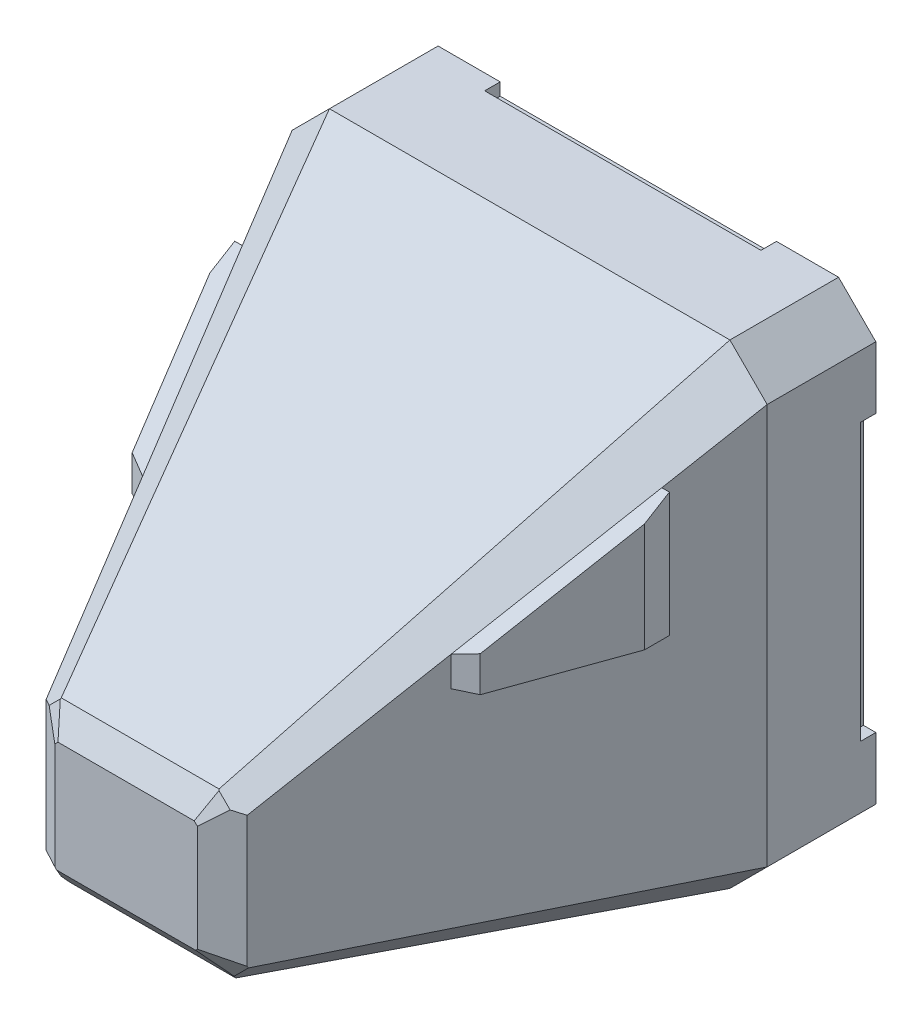
from build123d import *
from OCP.BRepFilletAPI import BRepFilletAPI_MakeChamfer

# Parameters (mm, degrees)
BOSS_EXTRUDE1_DEPTH            = 55
SKETCH2_W                      = 67.5
SKETCH2_H                      = 67.5
BOSS_EXTRUDE2_DEPTH            = 2.5
CUT_EXTRUDE1_REACH             = 75.378
SKETCH3_W                      = 16.5
SKETCH3_H                      = 7
SKETCH3_W_2                    = 8
SKETCH3_H_2                    = 16
FILLET1_R                      = 1
CUT_EXTRUDE2_REACH             = 77.187
SKETCH4_R                      = 1.5
MIRROR2_COPY_1_REACH           = 77.187
MIRROR2_COPY_1_SKETCH_R        = 1.5
BOSS_EXTRUDE3_DEPTH            = 16.09
BOSS_EXTRUDE3_DEPTH_BACK       = 23.81
BOSS_EXTRUDE4_DEPTH            = 47
SKETCH7_W                      = 39.9
SKETCH7_H                      = 19.5
CUT_EXTRUDE3_DEPTH             = 9.4
BOSS_EXTRUDE7_DEPTH            = 2
CUT_EXTRUDE6_REACH             = 85.213
CUT_EXTRUDE6_DIRECTION_2_DEPTH = 84.213490493
CUT_EXTRUDE7_REACH             = 74.438
SKETCH14_W                     = 14.7
SKETCH14_H                     = 2
CUT_EXTRUDE8_DEPTH             = 104.526192338
CUT_EXTRUDE8_DEPTH_BACK        = 2.5
SKETCH15_R                     = 1.6
SKETCH16_W                     = 7.5
SKETCH16_H                     = 2.5
BOSS_EXTRUDE8_DEPTH            = 7
CUT_EXTRUDE5_DEPTH             = 2
CUT_EXTRUDE9_REACH             = 74.438
SKETCH17_R                     = 1
SKETCH19_R                     = 3
CUT_EXTRUDE10_DEPTH            = 2.5
BOSS_EXTRUDE9_DEPTH            = 2
CIRPATTERN1_COUNT              = 4
CIRPATTERN2_COUNT              = 4
CUT_EXTRUDE11_DEPTH            = 2.5
BOSS_EXTRUDE12_DEPTH           = 55
CUT_EXTRUDE12_DEPTH            = 85.104012984
CUT_EXTRUDE12_DEPTH_BACK       = 85.104012984
SKETCH23_W                     = 53.743256412
SKETCH23_H                     = 84.17088144
BOSS_EXTRUDE13_DEPTH           = 15
BOSS_EXTRUDE14_DEPTH           = 35
BOSS_EXTRUDE14_DEPTH_BACK      = 35
CUT_EXTRUDE13_REACH            = 94.676
CHAMFER2_SIZE                  = 1.6
CHAMFER2_SIZE2                 = 2.645578105


with BuildPart() as part:
    # Sketch1 → Boss-Extrude1 (new body)
    with BuildSketch(Plane.XY):
        with BuildLine():
            Line((-36.25, 32.25), (-36.25, -32.25))
            ThreePointArc((-36.25, -32.25), (-35.078427125, -35.078427125), (-32.25, -36.25))
            Line((-32.25, -36.25), (32.25, -36.25))
            ThreePointArc((32.25, -36.25), (35.078427125, -35.078427125), (36.25, -32.25))
            Line((36.25, -32.25), (36.25, 32.25))
            ThreePointArc((36.25, 32.25), (35.078427125, 35.078427125), (32.25, 36.25))
            Line((32.25, 36.25), (-32.25, 36.25))
            ThreePointArc((-32.25, 36.25), (-35.078427125, 35.078427125), (-36.25, 32.25))
        make_face()
        with BuildLine():
            Line((-31.75, 33.75), (31.75, 33.75))
            ThreePointArc((31.75, 33.75), (33.164213562, 33.164213562), (33.75, 31.75))
            Line((33.75, 31.75), (33.75, -31.75))
            ThreePointArc((33.75, -31.75), (33.164213562, -33.164213562), (31.75, -33.75))
            Line((31.75, -33.75), (-31.75, -33.75))
            ThreePointArc((-31.75, -33.75), (-33.164213562, -33.164213562), (-33.75, -31.75))
            Line((-33.75, -31.75), (-33.75, 31.75))
            ThreePointArc((-33.75, 31.75), (-33.164213562, 33.164213562), (-31.75, 33.75))
        make_face(mode=Mode.SUBTRACT)
    extrude(amount=BOSS_EXTRUDE1_DEPTH)

    # Sketch2 → Boss-Extrude2 (add)
    with BuildSketch(Plane.XY):
        Rectangle(SKETCH2_W, SKETCH2_H)
    extrude(amount=BOSS_EXTRUDE2_DEPTH)

    # Sketch3 → Cut-Extrude1 (cut, up to next)
    with BuildSketch(Plane.XY.offset(2.5), mode=Mode.PRIVATE) as cut_extrude1_sk1:
        with Locations((-11.63, 14.79)):
            Rectangle(SKETCH3_W, SKETCH3_H)
    cut_extrude1_tool1 = extrude(cut_extrude1_sk1.sketch, amount=-CUT_EXTRUDE1_REACH, mode=Mode.PRIVATE) & part.part
    # Sketch3 → Cut-Extrude1 (cut, up to next)
    with BuildSketch(Plane.XY.offset(2.5), mode=Mode.PRIVATE) as cut_extrude1_sk2:
        Rectangle(SKETCH3_W_2, SKETCH3_H_2)
    cut_extrude1_tool2 = extrude(cut_extrude1_sk2.sketch, amount=-CUT_EXTRUDE1_REACH, mode=Mode.PRIVATE) & part.part
    add(cut_extrude1_tool1.solids().sort_by_distance((-11.63, 14.79, 2.5))[0], mode=Mode.SUBTRACT)
    add(cut_extrude1_tool2.solids().sort_by_distance((0, 0, 2.5))[0], mode=Mode.SUBTRACT)

    # Fillet1
    fillet1_edges = [part.edges().sort_by_distance(p)[0] for p in [
        (-19.88, 11.29, 1.25),
        (-19.88, 18.29, 1.25),
        (-3.38, 18.29, 1.25),
        (-3.38, 11.29, 1.25),
        (4, -8, 1.25),
        (-4, -8, 1.25),
        (-4, 8, 1.25),
        (4, 8, 1.25),
    ]]
    fillet(fillet1_edges, radius=FILLET1_R)

    # Sketch4 → Cut-Extrude2 (cut, up to next)
    with BuildSketch(Plane(origin=(0, 0, 0), x_dir=(-1, 0, 0), z_dir=(0, 0, -1)), mode=Mode.PRIVATE) as cut_extrude2_sk1:
        with Locations((-28.75, 28.75)):
            Circle(SKETCH4_R)
    cut_extrude2_tool1 = extrude(cut_extrude2_sk1.sketch, amount=-CUT_EXTRUDE2_REACH, mode=Mode.PRIVATE) & part.part
    cut_extrude2 = cut_extrude2_tool1.solids().sort_by_distance((28.75, 28.75, 0))[0]
    add(cut_extrude2, mode=Mode.SUBTRACT)

    # Mirror1: Cut-Extrude2 across plane
    add(cut_extrude2.mirror(Plane(origin=(0, 0, 0), x_dir=(0, 0, 1), z_dir=(1, 0, 0))), mode=Mode.SUBTRACT)

    # Mirror2: Cut-Extrude2 across plane
    add(cut_extrude2.mirror(Plane.ZX), mode=Mode.SUBTRACT)

    # Mirror2 copy 1 sketch → Mirror2 copy 1 (cut, up to next)
    with BuildSketch(Plane(origin=(0, 0, 0), x_dir=(1, 0, 0), z_dir=(0, 0, -1)), mode=Mode.PRIVATE) as mirror2_copy_1_sk1:
        with Locations((-28.75, 28.75)):
            Circle(MIRROR2_COPY_1_SKETCH_R)
    mirror2_copy_1_tool1 = extrude(mirror2_copy_1_sk1.sketch, amount=-MIRROR2_COPY_1_REACH, mode=Mode.PRIVATE) & part.part
    add(mirror2_copy_1_tool1.solids().sort_by_distance((-28.75, -28.75, 0))[0], mode=Mode.SUBTRACT)



with BuildPart() as body_2:
    # Sketch5 → Boss-Extrude3 (new, two sides: drawn at the far end of the back side and taken through both)
    with BuildSketch(Plane(origin=(0, 0, 0), x_dir=(0, 0, -1), z_dir=(1, 0, 0)).offset(-BOSS_EXTRUDE3_DEPTH_BACK)):
        Polygon((-14.7, 14), (-64.4, 14), (-64.4, 12), (-62.4, 12), (-16.7, 12), (-16.7, -12), (-62.4, -12), (-64.4, -12), (-64.4, -14), (-14.7, -14), align=None)
    extrude(amount=BOSS_EXTRUDE3_DEPTH + BOSS_EXTRUDE3_DEPTH_BACK)


with BuildPart() as part_1:
    add(part.part)

    add(body_2.part)  # Boss-Extrude4 merges body 2
    # Sketch6 → Boss-Extrude4 (add)
    with BuildSketch(Plane.XY.offset(64.4)):
        Polygon((-23.81, -14), (16.09, -14), (16.09, -16.5), (-2.11, -16.5), (-2.11, -31.25), (16.09, -31.25), (16.09, -33.75), (-23.81, -33.75), (-23.81, -31.25), (-5.61, -31.25), (-5.61, -16.5), (-23.81, -16.5), align=None)
    extrude(amount=-BOSS_EXTRUDE4_DEPTH)

    # Sketch7 → Cut-Extrude3 (cut)
    with BuildSketch(Plane.XY.offset(64.4)):
        with Locations((-3.86, -24)):
            Rectangle(SKETCH7_W, SKETCH7_H)
    extrude(amount=-CUT_EXTRUDE3_DEPTH, mode=Mode.SUBTRACT)

    # Sketch12 → Boss-Extrude7 (add)
    with BuildSketch(Plane(origin=(0, 36.25, 0), x_dir=(1, 0, 0), z_dir=(0, 1, 0))):
        Polygon((29.75, -55), (32.25, -55), (32.25, -52.5), (32.25, -45), (29.75, -45), (29.75, -52.5), (22.25, -52.5), (22.25, -55), align=None)
        Polygon((-32.25, 0), (-32.25, -10), (-29.75, -10), (-29.75, -2.5), (-22.25, -2.5), (-22.25, 0), align=None)
    boss_extrude7 = extrude(amount=BOSS_EXTRUDE7_DEPTH)

    # Sketch13 → Cut-Extrude6 (cut, up to next)
    with BuildSketch(Plane(origin=(0, 0, 0), x_dir=(-1, 0, 0), z_dir=(0, 0, -1)), mode=Mode.PRIVATE) as cut_extrude6_sk1:
        with BuildLine():
            Line((-33.75, 21.25), (-25.25, 21.25))
            ThreePointArc((-25.25, 21.25), (-22.421572875, 22.421572875), (-21.25, 25.25))
            Line((-21.25, 25.25), (-21.25, 33.75))
            Line((-21.25, 33.75), (21.25, 33.75))
            Line((21.25, 33.75), (21.25, 25.25))
            ThreePointArc((21.25, 25.25), (22.421572875, 22.421572875), (25.25, 21.25))
            Line((25.25, 21.25), (33.75, 21.25))
            Line((33.75, 21.25), (33.75, -21.25))
            Line((33.75, -21.25), (25.25, -21.25))
            ThreePointArc((25.25, -21.25), (22.421572875, -22.421572875), (21.25, -25.25))
            Line((21.25, -25.25), (21.25, -33.75))
            Line((21.25, -33.75), (-21.25, -33.75))
            Line((-21.25, -33.75), (-21.25, -25.25))
            ThreePointArc((-21.25, -25.25), (-22.421572875, -22.421572875), (-25.25, -21.25))
            Line((-25.25, -21.25), (-33.75, -21.25))
            Line((-33.75, -21.25), (-33.75, 21.25))
        make_face()
    cut_extrude6_tool1 = extrude(cut_extrude6_sk1.sketch, amount=-CUT_EXTRUDE6_REACH, mode=Mode.PRIVATE) & part_1.part
    add(cut_extrude6_tool1.solids().sort_by_distance((0, 0, 0))[0], mode=Mode.SUBTRACT)

    # Sketch13 → Cut-Extrude6 direction 2 (cut)
    with BuildSketch(Plane(origin=(0, 0, 0), x_dir=(-1, 0, 0), z_dir=(0, 0, -1))):
        with BuildLine():
            Line((-33.75, 21.25), (-25.25, 21.25))
            ThreePointArc((-25.25, 21.25), (-22.421572875, 22.421572875), (-21.25, 25.25))
            Line((-21.25, 25.25), (-21.25, 33.75))
            Line((-21.25, 33.75), (21.25, 33.75))
            Line((21.25, 33.75), (21.25, 25.25))
            ThreePointArc((21.25, 25.25), (22.421572875, 22.421572875), (25.25, 21.25))
            Line((25.25, 21.25), (33.75, 21.25))
            Line((33.75, 21.25), (33.75, -21.25))
            Line((33.75, -21.25), (25.25, -21.25))
            ThreePointArc((25.25, -21.25), (22.421572875, -22.421572875), (21.25, -25.25))
            Line((21.25, -25.25), (21.25, -33.75))
            Line((21.25, -33.75), (-21.25, -33.75))
            Line((-21.25, -33.75), (-21.25, -25.25))
            ThreePointArc((-21.25, -25.25), (-22.421572875, -22.421572875), (-25.25, -21.25))
            Line((-25.25, -21.25), (-33.75, -21.25))
            Line((-33.75, -21.25), (-33.75, 21.25))
        make_face()
    extrude(amount=CUT_EXTRUDE6_DIRECTION_2_DEPTH, mode=Mode.SUBTRACT)

    # Sketch14 → Cut-Extrude7 (cut, up to next)
    with BuildSketch(Plane(origin=(0, 0, 14.7), x_dir=(-1, 0, 0), z_dir=(0, 0, -1)), mode=Mode.PRIVATE) as cut_extrude7_sk1:
        with Locations((16.46, 13)):
            Rectangle(SKETCH14_W, SKETCH14_H)
    cut_extrude7_tool1 = extrude(cut_extrude7_sk1.sketch, amount=-CUT_EXTRUDE7_REACH, mode=Mode.PRIVATE) & part_1.part
    add(cut_extrude7_tool1.solids().sort_by_distance((-16.46, 13, 14.7))[0], mode=Mode.SUBTRACT)

    # Sketch15 → Cut-Extrude8 (cut, two sides: drawn at the far end of the back side and taken through both)
    with BuildSketch(Plane(origin=(0, 36.25, 0), x_dir=(1, 0, 0), z_dir=(0, 1, 0)).offset(-CUT_EXTRUDE8_DEPTH_BACK)):
        with Locations(Location((3.25, -45, 0), (0, 0, 90))):
            Circle(SKETCH15_R)
    extrude(amount=CUT_EXTRUDE8_DEPTH + CUT_EXTRUDE8_DEPTH_BACK, mode=Mode.SUBTRACT)

    # Sketch16 → Boss-Extrude8 (add)
    with BuildSketch(Plane(origin=(-33.75, 0, 0), x_dir=(0, 0, -1), z_dir=(1, 0, 0))):
        with Locations((-12.25, 30.9)):
            Rectangle(SKETCH16_W, SKETCH16_H)
    extrude(amount=BOSS_EXTRUDE8_DEPTH)

    # Sketch11 → Cut-Extrude5 (cut)
    with BuildSketch(Plane(origin=(0, 14, 0), x_dir=(1, 0, 0), z_dir=(0, 1, 0))):
        Polygon((1.19, -39.55), (12.59, -39.55), (12.59, -14.7), (16.09, -14.7), (16.09, -64.4), (12.59, -64.4), (1.19, -64.4), (-23.81, -64.4), (-23.81, -14.7), (1.19, -14.7), align=None)
    extrude(amount=-CUT_EXTRUDE5_DEPTH, mode=Mode.SUBTRACT)

    # Sketch17 → Cut-Extrude9 (cut, up to next)
    with BuildSketch(Plane(origin=(0, 0, 14.7), x_dir=(-1, 0, 0), z_dir=(0, 0, -1)), mode=Mode.PRIVATE) as cut_extrude9_sk1:
        with Locations(Location((-13.59, 9, 0), (0, 0, 90))):
            Circle(SKETCH17_R)
    cut_extrude9_tool1 = extrude(cut_extrude9_sk1.sketch, amount=-CUT_EXTRUDE9_REACH, mode=Mode.PRIVATE) & part_1.part
    # Sketch17 → Cut-Extrude9 (cut, up to next)
    with BuildSketch(Plane(origin=(0, 0, 14.7), x_dir=(-1, 0, 0), z_dir=(0, 0, -1)), mode=Mode.PRIVATE) as cut_extrude9_sk2:
        with Locations(Location((-13.59, -9, 0), (0, 0, 90))):
            Circle(SKETCH17_R)
    cut_extrude9_tool2 = extrude(cut_extrude9_sk2.sketch, amount=-CUT_EXTRUDE9_REACH, mode=Mode.PRIVATE) & part_1.part
    # Sketch17 → Cut-Extrude9 (cut, up to next)
    with BuildSketch(Plane(origin=(0, 0, 14.7), x_dir=(-1, 0, 0), z_dir=(0, 0, -1)), mode=Mode.PRIVATE) as cut_extrude9_sk3:
        with Locations(Location((21.31, -9, 0), (0, 0, 90))):
            Circle(SKETCH17_R)
    cut_extrude9_tool3 = extrude(cut_extrude9_sk3.sketch, amount=-CUT_EXTRUDE9_REACH, mode=Mode.PRIVATE) & part_1.part
    add(cut_extrude9_tool1.solids().sort_by_distance((13.59, 9, 14.7))[0], mode=Mode.SUBTRACT)
    add(cut_extrude9_tool2.solids().sort_by_distance((13.59, -9, 14.7))[0], mode=Mode.SUBTRACT)
    add(cut_extrude9_tool3.solids().sort_by_distance((-21.31, -9, 14.7))[0], mode=Mode.SUBTRACT)

    # Sketch19 → Cut-Extrude10 (cut)
    with BuildSketch(Plane(origin=(0, 36.25, 0), x_dir=(1, 0, 0), z_dir=(0, 1, 0))):
        with Locations(Location((0, -27.5, 0), (0, 0, 270))):
            Circle(SKETCH19_R)
    cut_extrude10 = extrude(amount=-CUT_EXTRUDE10_DEPTH, mode=Mode.SUBTRACT)

    # Sketch20 → Boss-Extrude9 (add)
    with BuildSketch(Plane(origin=(36.25, 0, -36.25), x_dir=(0, 0, 1), z_dir=(-1, 0, 0))):
        Polygon((91.25, 32.25), (81.25, 32.25), (81.25, 29.75), (88.75, 29.75), (88.75, 22.25), (91.25, 22.25), align=None)
        Polygon((36.25, -22.25), (36.25, -32.25), (46.25, -32.25), (46.25, -29.75), (38.75, -29.75), (38.75, -22.25), align=None)
    boss_extrude9 = extrude(amount=-BOSS_EXTRUDE9_DEPTH)

    # CirPattern1: Boss-Extrude7, Cut-Extrude10 ×4 about axis
    cirpattern1_axis = Axis((0, 0, 0), (0, 0, 1))
    add([boss_extrude7.rotate(cirpattern1_axis, i * 360 / CIRPATTERN1_COUNT) for i in range(1, CIRPATTERN1_COUNT)])
    add([cut_extrude10.rotate(cirpattern1_axis, i * 360 / CIRPATTERN1_COUNT) for i in range(1, CIRPATTERN1_COUNT)], mode=Mode.SUBTRACT)

    # CirPattern2: Boss-Extrude9 ×4 about axis
    cirpattern2_axis = Axis((0, 0, 0), (0, 0, 1))
    for i in range(1, CIRPATTERN2_COUNT):
        add(boss_extrude9.rotate(cirpattern2_axis, i * 360 / CIRPATTERN2_COUNT))

    # Sketch21 → Cut-Extrude11 (cut)
    with BuildSketch(Plane.XZ.offset(33.75)):
        with BuildLine():
            Line((-2.11, 25.367419404), (-2.11, 29.632580596))
            ThreePointArc((-2.11, 29.632580596), (3, 27.5), (-2.11, 25.367419404))
        make_face()
    extrude(amount=-CUT_EXTRUDE11_DEPTH, mode=Mode.SUBTRACT)

    # Sketch22 → Boss-Extrude12 (add, through all)
    with BuildSketch(Plane.XY.offset(55)):
        Polygon((-38.25, 32.25), (-32.25, 38.25), (-29.75, 38.25), (-29.75, 33.75), (-33.75, 33.75), (-33.75, 29.75), (-38.25, 29.75), align=None)
        Polygon((33.75, 33.75), (33.75, 29.75), (38.25, 29.75), (38.25, 32.25), (32.25, 38.25), (29.75, 38.25), (29.75, 33.75), align=None)
        Polygon((38.25, -32.25), (32.25, -38.25), (29.75, -38.25), (29.75, -33.75), (33.75, -33.75), (33.75, -29.75), (38.25, -29.75), align=None)
        Polygon((-33.75, -33.75), (-33.75, -29.75), (-38.25, -29.75), (-38.25, -32.25), (-32.25, -38.25), (-29.75, -38.25), (-29.75, -33.75), align=None)
    extrude(amount=-BOSS_EXTRUDE12_DEPTH)

    # Sketch23 → Cut-Extrude12 (cut, two sides: drawn at the far end of the back side and taken through both)
    with BuildSketch(Plane(origin=(0, 0, 0), x_dir=(0, 0, -1), z_dir=(1, 0, 0)).offset(-CUT_EXTRUDE12_DEPTH_BACK)):
        with Locations((-29.371628206, -1.519752026)):
            Rectangle(SKETCH23_W, SKETCH23_H)
    extrude(amount=CUT_EXTRUDE12_DEPTH + CUT_EXTRUDE12_DEPTH_BACK, mode=Mode.SUBTRACT)


with BuildPart() as body_2_2:
    # of the pieces the cut leaves, the one that is kept (cut_extrude12_keep)
    add(part_1.part.solids().sort_by_distance((-36.25, 22.25, 0))[0])



with BuildPart() as body_2_3:
    # Loft1: read off the stored shape, not the designer's step
    # Loft1: loft between two sections, ruled curve by curve
    loft1_from = [
        Edge.make_line((-15, -26.256240287, 82.5), (-15, -7.256240287, 82.5)),
        Edge.make_line((-15, -7.256240287, 82.5), (-12, -4.256240287, 82.5)),
        Edge.make_line((-12, -29.256240287, 82.5), (-15, -26.256240287, 82.5)),
        Edge.make_line((12, -29.256240287, 82.5), (-12, -29.256240287, 82.5)),
        Edge.make_line((15, -26.256240287, 82.5), (12, -29.256240287, 82.5)),
        Edge.make_line((15, -7.256240287, 82.5), (15, -26.256240287, 82.5)),
        Edge.make_line((12, -4.256240287, 82.5), (15, -7.256240287, 82.5)),
        Edge.make_line((-12, -4.256240287, 82.5), (12, -4.256240287, 82.5)),
    ]
    loft1_to = [
        Edge.make_line((-38.25, -32.25, 17.5), (-38.25, 32.25, 17.5)),
        Edge.make_line((-38.25, 32.25, 17.5), (-32.25, 38.25, 17.5)),
        Edge.make_line((-32.25, -38.25, 17.5), (-38.25, -32.25, 17.5)),
        Edge.make_line((32.25, -38.25, 17.5), (-32.25, -38.25, 17.5)),
        Edge.make_line((38.25, -32.25, 17.5), (32.25, -38.25, 17.5)),
        Edge.make_line((38.25, 32.25, 17.5), (38.25, -32.25, 17.5)),
        Edge.make_line((32.25, 38.25, 17.5), (38.25, 32.25, 17.5)),
        Edge.make_line((-32.25, 38.25, 17.5), (32.25, 38.25, 17.5)),
    ]
    loft1 = Solid(Shell([*[Face.make_surface_from_curves(loft1_from[k], loft1_to[k]) for k in range(8)], Face(Wire(loft1_from)), Face(Wire(loft1_to))]))
    add(loft1)


with BuildPart() as body_2_2_1:
    add(body_2_2.part)

    add(body_2_3.part)  # Boss-Extrude13 merges body 2 3
    # Sketch29 → Boss-Extrude13 (add)
    with BuildSketch(Plane.XY.offset(2.5)):
        Polygon((-38.25, -32.25), (-32.25, -38.25), (32.25, -38.25), (38.25, -32.25), (38.25, 32.25), (32.25, 38.25), (-32.25, 38.25), (-38.25, 32.25), align=None)
        Polygon((-33.75, -30.386038969), (-30.386038969, -33.75), (30.386038969, -33.75), (33.75, -30.386038969), (33.75, 30.386038969), (30.386038969, 33.75), (-30.386038969, 33.75), (-33.75, 30.386038969), align=None, mode=Mode.SUBTRACT)
    extrude(amount=BOSS_EXTRUDE13_DEPTH)

    # Sketch30 → Boss-Extrude14 (add, two sides: drawn at the far end of the back side and taken through both)
    with BuildSketch(Plane.ZY.offset(-BOSS_EXTRUDE14_DEPTH_BACK)):
        Polygon((55, 4.652646099), (55, 9.457938296), (30, 24.652646099), (30, 4.652646099), align=None)
    extrude(amount=BOSS_EXTRUDE14_DEPTH + BOSS_EXTRUDE14_DEPTH_BACK)

    # Cut-Extrude13: up to this plane
    cut_extrude13_end = Plane(origin=(35, 31.317429352, 19.034367525), z_dir=(0, 0.8545427354341548, 0.5193810867914928))
    # Sketch31 → Cut-Extrude13 (cut, up to the surface)
    with BuildSketch(Plane(origin=(0, 0, 7.249003184), x_dir=(1, 0, 0), z_dir=(0, 1, 0)), mode=Mode.PRIVATE) as cut_extrude13_sk1:
        Polygon((26.055561267, -51.765885066), (36.727591717, -21.930101014), (36.727591717, -51.765885066), align=None)
    cut_extrude13_tool1 = split(extrude(cut_extrude13_sk1.sketch, amount=CUT_EXTRUDE13_REACH, mode=Mode.PRIVATE), bisect_by=cut_extrude13_end, keep=Keep.BOTH, mode=Mode.PRIVATE)
    add(cut_extrude13_tool1.solids().sort_by_distance((33.170248, 0, 49.069627))[0], mode=Mode.SUBTRACT)
    # Sketch31 → Cut-Extrude13 (cut, up to the surface)
    with BuildSketch(Plane(origin=(0, 0, 7.249003184), x_dir=(1, 0, 0), z_dir=(0, 1, 0)), mode=Mode.PRIVATE) as cut_extrude13_sk2:
        Polygon((-36.727591717, -51.765885066), (-26.055561267, -51.765885066), (-36.727591717, -21.930101014), align=None)
    cut_extrude13_tool2 = split(extrude(cut_extrude13_sk2.sketch, amount=CUT_EXTRUDE13_REACH, mode=Mode.PRIVATE), bisect_by=cut_extrude13_end, keep=Keep.BOTH, mode=Mode.PRIVATE)
    add(cut_extrude13_tool2.solids().sort_by_distance((-33.170248, 0, 49.069627))[0], mode=Mode.SUBTRACT)

    # Fillet2
    # the kernel refuses this chamfer: 5 mm, written as the material it takes off along each edge
    with BuildSketch(Plane(origin=(-5.247952216, -36.008288071, 82.5), x_dir=(-0.21436575688805004, -0.21436575688805004, -0.9529400004972123), z_dir=(-0.7071067811865476, 0.7071067811865476, 0))) as fillet2_piece_1:
        with BuildLine():
            Line((3.817710171, 0.118054313), (-1.269871725, -3.602259509))
            Line((-1.269871725, -3.602259509), (-1.365165725, -3.571943613))
            ThreePointArc((-1.365165725, -3.571943613), (-0.673980524, -1.78870847), (-0.095294, 0.030315896))
            Line((-0.095294, 0.030315896), (0, 0.1))
            ThreePointArc((0, 0.1), (1.908855085, 0.1), (3.817710171, 0.218054313))
            Line((3.817710171, 0.218054313), (3.817710171, 0.118054313))
        make_face()
    extrude(amount=23.340315788, mode=Mode.SUBTRACT)
    with BuildSketch(Plane(origin=(23.271310582, -29.256240287, 82.5), x_dir=(0, 1, 0), z_dir=(-1, 0, 0))) as fillet2_piece_2:
        with BuildLine():
            Line((4.506609807, -0.131372771), (-0.747807784, 4.446074029))
            Line((-0.747807784, 4.446074029), (-0.846864062, 4.432368055))
            ThreePointArc((-0.846864062, 4.432368055), (-0.407893681, 2.218333999), (-0.099056278, -0.013705975))
            Line((-0.099056278, -0.013705975), (0, -0.1))
            ThreePointArc((0, -0.1), (2.253304903, -0.1), (4.506609807, -0.231372771))
            Line((4.506609807, -0.231372771), (4.506609807, -0.131372771))
        make_face()
    extrude(amount=46.542621164, mode=Mode.SUBTRACT)
    with BuildSketch(Plane(origin=(21.752047784, -19.504192503, 82.5), x_dir=(-0.7071067811865475, 0.7071067811865475, -1.166012717588788e-14), z_dir=(-0.7071067811865476, -0.7071067811865476, 0))) as fillet2_piece_3:
        with BuildLine():
            Line((3.817710171, -0.118054313), (-1.269871725, 3.602259509))
            Line((-1.269871725, 3.602259509), (-1.365165725, 3.571943613))
            ThreePointArc((-1.365165725, 3.571943613), (-0.673980524, 1.78870847), (-0.095294, -0.030315896))
            Line((-0.095294, -0.030315896), (0, -0.1))
            ThreePointArc((0, -0.1), (1.908855085, -0.1), (3.817710171, -0.218054313))
            Line((3.817710171, -0.218054313), (3.817710171, -0.118054313))
        make_face()
    extrude(amount=23.340315788, mode=Mode.SUBTRACT)
    with BuildSketch(Plane(origin=(15, 1.961468954, 82.5), x_dir=(-1, 0, 0), z_dir=(0, -1, 0))) as fillet2_piece_4:
        with BuildLine():
            Line((3.685284533, -0.115169859), (-1.349627479, 3.43119394))
            Line((-1.349627479, 3.43119394), (-1.443785272, 3.397514421))
            ThreePointArc((-1.443785272, 3.397514421), (-0.714750834, 1.701311778), (-0.094157793, -0.033679518))
            Line((-0.094157793, -0.033679518), (0, -0.1))
            ThreePointArc((0, -0.1), (1.842642266, -0.1), (3.685284533, -0.215169859))
            Line((3.685284533, -0.215169859), (3.685284533, -0.115169859))
        make_face()
    extrude(amount=37.435418481, mode=Mode.SUBTRACT)
    with BuildSketch(Plane(origin=(-15, -35.473949528, 82.5), x_dir=(-0.33679518377841833, 0, -0.9415779331439652), z_dir=(0, 1, 0))) as fillet2_piece_5:
        with BuildLine():
            Line((3.685284533, 0.115169859), (-1.349627479, -3.43119394))
            Line((-1.349627479, -3.43119394), (-1.443785272, -3.397514421))
            ThreePointArc((-1.443785272, -3.397514421), (-0.714750834, -1.701311778), (-0.094157793, 0.033679518))
            Line((-0.094157793, 0.033679518), (0, 0.1))
            ThreePointArc((0, 0.1), (1.842642266, 0.1), (3.685284533, 0.215169859))
            Line((3.685284533, 0.215169859), (3.685284533, 0.115169859))
        make_face()
    extrude(amount=37.435418481, mode=Mode.SUBTRACT)
    with BuildSketch(Plane(origin=(-19.983321594, -12.239561881, 82.5), x_dir=(-0.39868992538477815, 0.39868992538477815, -0.8258890281347488), z_dir=(0.7071067811865476, 0.7071067811865476, 0))) as fillet2_piece_6:
        with BuildLine():
            Line((2.817444723, 0.093398854), (-1.665704554, -2.274235356))
            Line((-1.665704554, -2.274235356), (-1.748293456, -2.217852086))
            ThreePointArc((-1.748293456, -2.217852086), (-0.876872635, -1.107065072), (-0.082588903, 0.05638327))
            Line((-0.082588903, 0.05638327), (0, 0.1))
            ThreePointArc((0, 0.1), (1.408722362, 0.1), (2.817444723, 0.193398854))
            Line((2.817444723, 0.193398854), (2.817444723, 0.093398854))
        make_face()
    extrude(amount=18.337602655, mode=Mode.SUBTRACT)
    with BuildSketch(Plane(origin=(7.016678406, 0.727081307, 82.5), x_dir=(-0.7071067811865476, -0.7071067811865476, -1.61450741225738e-14), z_dir=(0.7071067811865476, -0.7071067811865476, 0))) as fillet2_piece_7:
        with BuildLine():
            Line((2.817444723, -0.093398854), (-1.665704554, 2.274235356))
            Line((-1.665704554, 2.274235356), (-1.748293456, 2.217852086))
            ThreePointArc((-1.748293456, 2.217852086), (-0.876872635, 1.107065072), (-0.082588903, -0.05638327))
            Line((-0.082588903, -0.05638327), (0, -0.1))
            ThreePointArc((0, -0.1), (1.408722362, -0.1), (2.817444723, -0.193398854))
            Line((2.817444723, -0.193398854), (2.817444723, -0.093398854))
        make_face()
    extrude(amount=18.337602655, mode=Mode.SUBTRACT)
    with BuildSketch(Plane(origin=(-19.204926804, -4.256240287, 82.5), x_dir=(0, -1, 0), z_dir=(1, 0, 0))) as fillet2_piece_8:
        with BuildLine():
            Line((2.880399513, -0.095151916), (-1.656094682, 2.358623676))
            Line((-1.656094682, 2.358623676), (-1.739787962, 2.303893112))
            ThreePointArc((-1.739787962, 2.303893112), (-0.871922742, 1.150619864), (-0.083693281, -0.054730565))
            Line((-0.083693281, -0.054730565), (0, -0.1))
            ThreePointArc((0, -0.1), (1.440199756, -0.1), (2.880399513, -0.195151916))
            Line((2.880399513, -0.195151916), (2.880399513, -0.095151916))
        make_face()
    extrude(amount=38.409853609, mode=Mode.SUBTRACT)

    # Chamfer2: one chamfer whose edges measure the first distance from different faces: ONE call of the kernel's chamfer builder (chamfer() names one face for all edges)
    chamfer2_edges_1 = [body_2_2_1.edges().sort_by_distance(p)[0] for p in [
        (27.491655911, 7.055292197, 55),
    ]]
    chamfer2_side_1 = [body_2_2_1.faces().sort_by_distance(p)[0] for p in [
        (31.959566033, 10.851213292, 42.509068474),
    ]]
    chamfer2_edges_2 = [body_2_2_1.edges().sort_by_distance(p)[0] for p in [
        (-27.491655911, 7.055292197, 55),
    ]]
    chamfer2_side_2 = [body_2_2_1.faces().sort_by_distance(p)[0] for p in [
        (-31.959566033, 10.851213292, 42.509068474),
    ]]
    chamfer2 = BRepFilletAPI_MakeChamfer(body_2_2_1.part.solid().wrapped)
    for e in chamfer2_edges_1:
        chamfer2.Add(CHAMFER2_SIZE, CHAMFER2_SIZE2, e.wrapped, chamfer2_side_1[0].wrapped)  # the first distance lies on this face
    for e in chamfer2_edges_2:
        chamfer2.Add(CHAMFER2_SIZE, CHAMFER2_SIZE2, e.wrapped, chamfer2_side_2[0].wrapped)  # the first distance lies on this face
    add(Compound.cast(chamfer2.Shape()), mode=Mode.REPLACE)


solid = body_2_2_1.part
